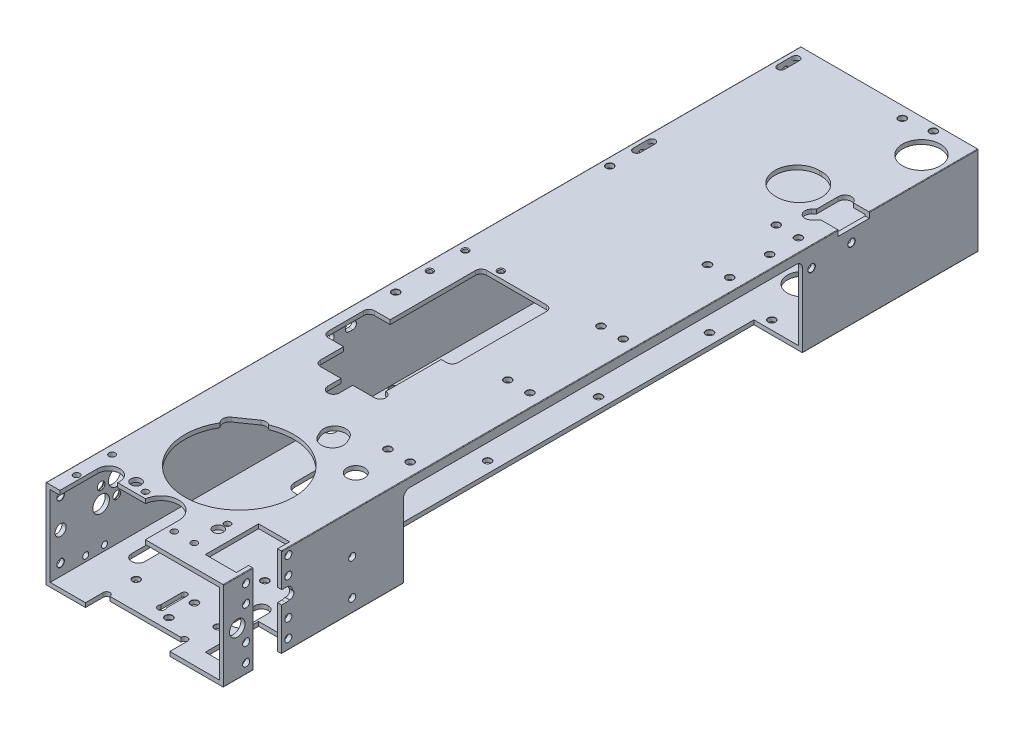
from build123d import *

# Parameters (mm, degrees)
SKETCH_1_W                  = 80
SKETCH_1_H                  = 40
SKETCH_1_W_2                = 76.2
SKETCH_1_H_2                = 36.2
EXTRUDE_1_DEPTH             = 340
FILLET_1_R                  = 0.25
CUT_EXTRUDE_1_REACH         = 346.674
SKETCH_2_R                  = 24.5
CUT_EXTRUDE_2813_REACH      = 346.458
SKETCH_124_R                = 1.6
CUT_EXTRUDE_4_REACH         = 346.674
CUT_EXTRUDE_5_DEPTH         = 22
SKETCH_53_R                 = 8.5
CUT_EXTRUDE_10_DEPTH        = 345.673758792
CUT_EXTRUDE_29_DEPTH        = 2.5
HOLE_WIZARD_3_2_AT_2_COUNT  = 2
HOLE_WIZARD_3_2_AT_2_PITCH  = 18.022485955
CUT_EXTRUDE_21_REACH        = 346.674
HOLE_WIZARD_3_D             = 3.2
HOLE_WIZARD_3_DEPTH         = 1.9
HOLE_WIZARD_3_CSINK_D       = 3.4
HOLE_WIZARD_3_CSINK_ANGLE   = 90
HOLE_WIZARD_3_TIP           = 0.96137699
HOLE_WIZARD_3_3_AT_2_COUNT  = 2
HOLE_WIZARD_3_3_AT_2_PITCH  = 50
HOLE_WIZARD_3_3_AT_3_COUNT  = 2
HOLE_WIZARD_3_3_AT_3_PITCH  = 100
HOLE_WIZARD_3_3_AT_4_COUNT  = 2
HOLE_WIZARD_3_3_AT_4_PITCH  = 50
HOLE_WIZARD_3_3_AT_5_COUNT  = 2
HOLE_WIZARD_3_3_AT_5_PITCH  = 119.34743399
HOLE_WIZARD_3_3_AT_6_COUNT  = 2
HOLE_WIZARD_3_3_AT_6_PITCH  = 189.1692364
HOLE_WIZARD_3_3_AT_7_COUNT  = 2
HOLE_WIZARD_3_3_AT_7_PITCH  = 189.002645484
HOLE_WIZARD_3_3_AT_8_COUNT  = 2
HOLE_WIZARD_3_3_AT_8_PITCH  = 194.054116164
HOLE_WIZARD_3_3_AT_9_COUNT  = 2
HOLE_WIZARD_3_3_AT_9_PITCH  = 125.566954252
HOLE_WIZARD_3_3_AT_10_COUNT = 2
HOLE_WIZARD_3_3_AT_10_PITCH = 129.740741481
HOLE_WIZARD_3_3_AT_11_COUNT = 2
HOLE_WIZARD_3_3_AT_11_PITCH = 108.772974585
HOLE_WIZARD_3_3_AT_12_COUNT = 2
HOLE_WIZARD_3_3_AT_12_PITCH = 74.271528865
HOLE_WIZARD_3_3_AT_13_COUNT = 2
HOLE_WIZARD_3_3_AT_13_PITCH = 71.85165273
HOLE_WIZARD_3_3_AT_14_COUNT = 2
HOLE_WIZARD_3_3_AT_14_PITCH = 121.961510322
HOLE_WIZARD_3_3_AT_15_COUNT = 2
HOLE_WIZARD_3_3_AT_15_PITCH = 133.421737359
HOLE_WIZARD_3_3_AT_16_COUNT = 2
HOLE_WIZARD_3_3_AT_16_PITCH = 97.059569338
HOLE_WIZARD_3_3_AT_17_COUNT = 2
HOLE_WIZARD_3_3_AT_17_PITCH = 101.652151969
CUT_EXTRUDE_1_2_REACH       = 346.674
SKETCH_90_R                 = 2.35
CUT_EXTRUDE_18376_REACH     = 346.674
CUT_EXTRUDE_27_REACH        = 346.674
SKETCH_81_R                 = 7
SKETCH_81_R_2               = 2.5
CUT_EXTRUDE_28_REACH        = 346.674
HOLE_WIZARD_M3_AT_2_COUNT   = 2
HOLE_WIZARD_M3_AT_2_PITCH   = 305.285505716
HOLE_WIZARD_M3_AT_3_COUNT   = 2
HOLE_WIZARD_M3_AT_3_PITCH   = 312.130200077
HOLE_WIZARD_M3_AT_4_COUNT   = 2
HOLE_WIZARD_M3_AT_4_PITCH   = 330.801042925
HOLE_WIZARD_M3_AT_5_COUNT   = 2
HOLE_WIZARD_M3_AT_5_PITCH   = 330.392085256
HOLE_WIZARD_M3_AT_6_COUNT   = 2
HOLE_WIZARD_M3_AT_6_PITCH   = 21.475800334
HOLE_WIZARD_M3_AT_7_COUNT   = 2
HOLE_WIZARD_M3_AT_7_PITCH   = 72.154071264
CUT_EXTRUDE_33_REACH        = 346.674
HOLE_WIZARD_4_40_D          = 3.2
HOLE_WIZARD_4_40_DEPTH      = 1.9
SKETCH_113_R                = 4
HD_1440A_DEPTH              = 12
HOLE_WIZARD_4_40_2_D        = 2.8448
HOLE_WIZARD_4_40_2_DEPTH    = 1.9
CUT_EXTRUDE_START           = -40
CUT_EXTRUDE_38_DEPTH        = 40
HOLE_WIZARD_3_2_2_D         = 3.2
HOLE_WIZARD_3_2_2_DEPTH     = 1.9
CUT_EXTRUDE_44_REACH        = 351.857
CUT_EXTRUDE_45_REACH        = 351.857
SKETCH_122_R                = 3.5
CUT_EXTRUDE_46_REACH        = 351.857
SKETCH_123_R                = 2.5
CUT_EXTRUDE_47_DEPTH        = 2.5
CUT_EXTRUDE_49_DEPTH        = 1.9
CUT_EXTRUDE_43506_REACH     = 346.674
CUT_EXTRUDE_50_REACH        = 351.857
SKETCH_130_R                = 1.35
CUT_EXTRUDE_51_REACH        = 346.458
SKETCH_131_R                = 3
F_4_40_SD_AT_2_COUNT        = 2
F_4_40_SD_AT_2_PITCH        = 16
F_4_40_SD_AT_3_COUNT        = 2
F_4_40_SD_AT_3_PITCH        = 22.627416998
HOLE_START                  = 38.1
HOLE_WIZARD_5_DEPTH         = 1.9
CUT_EXTRUDE_52_REACH        = 351.857
SKETCH_136_R                = 3.75


# Read off the part's stored shape, not the designer's step: Вырез-Вытянуть38, Зенковка для адаптера 5Ю
with BuildPart() as part:
    # Эскиз1 → Вытянуть1 (new body)
    with BuildSketch(Plane.XY):
        Rectangle(SKETCH_1_W, SKETCH_1_H)
        Rectangle(SKETCH_1_W_2, SKETCH_1_H_2, mode=Mode.SUBTRACT)
    extrude(amount=-EXTRUDE_1_DEPTH)

    # Скругление1
    fillet_1_edges = [part.edges().sort_by_distance(p)[0] for p in [
        (-40, 20, -170),
        (40, 20, -170),
        (40, -20, -170),
        (-40, -20, -170),
    ]]
    fillet(fillet_1_edges, radius=FILLET_1_R)

    # Эскиз2 → Cut-Extrude 1 (cut, up to next)
    with BuildSketch(Plane(origin=(0, 20, 0), x_dir=(-1, 0, 0), z_dir=(0, 1, 0)), mode=Mode.PRIVATE) as cut_extrude_1_sk1:
        with Locations((2.9, -50)):
            Circle(SKETCH_2_R)
    cut_extrude_1_tool1 = extrude(cut_extrude_1_sk1.sketch, amount=-CUT_EXTRUDE_1_REACH, mode=Mode.PRIVATE) & part.part
    # Эскиз2 → Cut-Extrude 1 (cut, up to next)
    with BuildSketch(Plane(origin=(0, 20, 0), x_dir=(-1, 0, 0), z_dir=(0, 1, 0)), mode=Mode.PRIVATE) as cut_extrude_1_sk2:
        with BuildLine():
            Line((15.806264575, -72.703075562), (23.711066125, -67.168073929))
            ThreePointArc((23.711066125, -67.168073929), (24.985142752, -64.887075741), (23.987750923, -62.472239614))
            ThreePointArc((23.987750923, -62.472239614), (18.95587085, -68.505648091), (12.273015665, -72.636178506))
            ThreePointArc((12.273015665, -72.636178506), (14.028744699, -73.245081853), (15.806264575, -72.703075562))
        make_face()
    cut_extrude_1_tool2 = extrude(cut_extrude_1_sk2.sketch, amount=-CUT_EXTRUDE_1_REACH, mode=Mode.PRIVATE) & part.part
    add(cut_extrude_1_tool1.solids().sort_by_distance((-2.9, 20, -50))[0], mode=Mode.SUBTRACT)
    add(cut_extrude_1_tool2.solids().sort_by_distance((-20.008621, 20, -68.33218))[0], mode=Mode.SUBTRACT)

    # Эскиз124 → Cut-Extrude 2813 (cut, up to next)
    with BuildSketch(Plane(origin=(0, -18.1, 0), x_dir=(1, 0, 0), z_dir=(0, 1, 0)), mode=Mode.PRIVATE) as cut_extrude_2813_sk1:
        with Locations(Location((-3.21, 15.2, 0), (0, 0, 270))):
            Circle(SKETCH_124_R)
    cut_extrude_2813_tool1 = extrude(cut_extrude_2813_sk1.sketch, amount=-CUT_EXTRUDE_2813_REACH, mode=Mode.PRIVATE) & part.part
    add(cut_extrude_2813_tool1.solids().sort_by_distance((-3.21, -18.1, -15.2))[0], mode=Mode.SUBTRACT)

    # Эскиз6 → Вырез-Вытянуть4 (cut, up to next)
    with BuildSketch(Plane.XZ.offset(20), mode=Mode.PRIVATE) as cut_extrude_4_sk1:
        with BuildLine():
            Line((-28, -42.5), (-27.9, -42.5))
            ThreePointArc((-27.9, -42.5), (-25.778679656, -41.621320344), (-24.9, -39.5))
            Line((-24.9, -39.5), (-24.9, -29.5))
            ThreePointArc((-24.9, -29.5), (-25.778679656, -27.378679656), (-27.9, -26.5))
            Line((-27.9, -26.5), (-28, -26.5))
            ThreePointArc((-28, -26.5), (-30.121320344, -27.378679656), (-31, -29.5))
            Line((-31, -29.5), (-31, -39.5))
            ThreePointArc((-31, -39.5), (-30.121320344, -41.621320344), (-28, -42.5))
        make_face()
    cut_extrude_4_tool1 = extrude(cut_extrude_4_sk1.sketch, amount=-CUT_EXTRUDE_4_REACH, mode=Mode.PRIVATE) & part.part
    # Эскиз6 → Вырез-Вытянуть4 (cut, up to next)
    with BuildSketch(Plane.XZ.offset(20), mode=Mode.PRIVATE) as cut_extrude_4_sk2:
        with BuildLine():
            Line((20.1, -40), (20.2, -40))
            ThreePointArc((20.2, -40), (22.321320344, -39.121320344), (23.2, -37))
            Line((23.2, -37), (23.2, -27))
            ThreePointArc((23.2, -27), (22.321320344, -24.878679656), (20.2, -24))
            Line((20.2, -24), (20.1, -24))
            ThreePointArc((20.1, -24), (17.978679656, -24.878679656), (17.1, -27))
            Line((17.1, -27), (17.1, -37))
            ThreePointArc((17.1, -37), (17.978679656, -39.121320344), (20.1, -40))
        make_face()
    cut_extrude_4_tool2 = extrude(cut_extrude_4_sk2.sketch, amount=-CUT_EXTRUDE_4_REACH, mode=Mode.PRIVATE) & part.part
    add(cut_extrude_4_tool1.solids().sort_by_distance((-27.95, -20, -34.5))[0], mode=Mode.SUBTRACT)
    add(cut_extrude_4_tool2.solids().sort_by_distance((20.15, -20, -32))[0], mode=Mode.SUBTRACT)

    # Эскиз7 → Вырез-Вытянуть5 (cut)
    with BuildSketch(Plane(origin=(40, 0, 0), x_dir=(0, 0, -1), z_dir=(1, 0, 0))):
        with BuildLine():
            Line((81, -20), (81, 13))
            ThreePointArc((81, 13), (81.878679656, 15.121320344), (84, 16))
            Line((84, 16), (258, 16))
            ThreePointArc((258, 16), (260.121320344, 15.121320344), (261, 13))
            Line((261, 13), (261, -20))
            Line((261, -20), (81, -20))
        make_face()
    extrude(amount=-CUT_EXTRUDE_5_DEPTH, mode=Mode.SUBTRACT)

    # Эскиз53 → Вырез-Вытянуть10 (cut, through all)
    with BuildSketch(Plane(origin=(0, 20, 0), x_dir=(1, 0, 0), z_dir=(0, 1, 0))):
        with Locations(Location((29.5, 325, 0), (0, 0, 270))):
            Circle(SKETCH_53_R)
    extrude(amount=-CUT_EXTRUDE_10_DEPTH, mode=Mode.SUBTRACT)

    # Эскиз83 → Вырез-Вытянуть29 (cut)
    with BuildSketch(Plane(origin=(0, 20, 0), x_dir=(1, 0, 0), z_dir=(0, 1, 0))):
        with BuildLine():
            Line((40, 291), (32.828427125, 291))
            ThreePointArc((32.828427125, 291), (29.492694064, 292.956795679), (27, 290))
            Line((27, 290), (27, 280.242640687))
            Line((27, 280.242640687), (25.878679656, 279.121320344))
            ThreePointArc((25.878679656, 279.121320344), (25.878679656, 274.878679656), (30.121320344, 274.878679656))
            Line((30.121320344, 274.878679656), (32.242640687, 277))
            Line((32.242640687, 277), (40, 277))
            Line((40, 277), (40, 291))
        make_face()
    extrude(amount=-CUT_EXTRUDE_29_DEPTH, mode=Mode.SUBTRACT)

    # Эскиз59 → Hole Wizard 3.2 (revolve, cut)
    with BuildSketch(Plane(origin=(40, 12, -283), x_dir=(0, 0, -1), z_dir=(0, 1, 0))):
        Polygon((0, 0), (0, 1.9), (1.7, 1.9), (1.6, 1.8), (1.6, 0.1), (1.7, 0), align=None)
    hole_wizard_3_2 = revolve(axis=Axis((46.35, 12, -283), (-1, 0, 0)), mode=Mode.SUBTRACT)

    # Hole Wizard 3.2 at 2: Hole Wizard 3.2 ×2
    with Locations(*[Vector(0, -0.04993761694389213, 0.9987523388778448) * (i * HOLE_WIZARD_3_2_AT_2_PITCH) for i in range(1, HOLE_WIZARD_3_2_AT_2_COUNT)]):
        add(hole_wizard_3_2, mode=Mode.SUBTRACT)

    # Эскиз66 → Вырез-Вытянуть21 (cut, up to next)
    with BuildSketch(Plane(origin=(0, 20, 0), x_dir=(1, 0, 0), z_dir=(0, 1, 0)), mode=Mode.PRIVATE) as cut_extrude_21_sk1:
        with BuildLine():
            Line((-33.71, 17), (-33.71, 0))
            Line((-33.71, 0), (4.79, 0))
            Line((4.79, 0), (4.79, 15))
            ThreePointArc((4.79, 15), (-2.7090167, 22.984298074), (-11.147253933, 16))
            Line((-11.147253933, 16), (-23.71, 16))
            Line((-23.71, 16), (-23.71, 17))
            ThreePointArc((-23.71, 17), (-28.71, 22), (-33.71, 17))
        make_face()
    cut_extrude_21_tool1 = extrude(cut_extrude_21_sk1.sketch, amount=-CUT_EXTRUDE_21_REACH, mode=Mode.PRIVATE) & part.part
    add(cut_extrude_21_tool1.solids().sort_by_distance((-14.127994, 20, -9.929758))[0], mode=Mode.SUBTRACT)

    # Hole Wizard 3
    with Locations(Plane(origin=(0, 20, 0), x_dir=(-1, 0, 0), z_dir=(0, 1, 0))):
        with Locations((-34.1, -90), (-34.1, -144), (-34.1, -265), (-24.1, -265), (-34.1, -252), (-24.1, -234), (-24.1, -186), (-10.9, -335), (-22.9, -337), (-24.1, -144), (-24.1, -90), (-34.1, -186), (-34.1, -234), (36.4, -250.5), (35.4, -153)):
            CounterSinkHole(HOLE_WIZARD_3_D / 2, HOLE_WIZARD_3_CSINK_D / 2, depth=HOLE_WIZARD_3_DEPTH, counter_sink_angle=HOLE_WIZARD_3_CSINK_ANGLE)
            with Locations((0, 0, -(HOLE_WIZARD_3_DEPTH + HOLE_WIZARD_3_TIP / 2))):  # 118° drill point
                Cone(0, HOLE_WIZARD_3_D / 2, HOLE_WIZARD_3_TIP, mode=Mode.SUBTRACT)

    # Эскиз71 → Hole Wizard 3 3 (revolve, cut)
    with BuildSketch(Plane(origin=(13, -20, -146), x_dir=(0, 0, -1), z_dir=(1, 0, 0))):
        Polygon((0, 0), (0, 1.9), (1.7, 1.9), (1.6, 1.8), (1.6, 0.1), (1.7, 0), align=None)
    hole_wizard_3_3 = revolve(axis=Axis((13, -26.35, -146), (0, 1, 0)), mode=Mode.SUBTRACT)

    # Hole Wizard 3 3 at 2: Hole Wizard 3 3 ×2
    with Locations(*[(0, 0, -i * HOLE_WIZARD_3_3_AT_2_PITCH) for i in range(1, HOLE_WIZARD_3_3_AT_2_COUNT)]):
        add(hole_wizard_3_3, mode=Mode.SUBTRACT)

    # Hole Wizard 3 3 at 3: Hole Wizard 3 3 ×2
    with Locations(*[(0, 0, -i * HOLE_WIZARD_3_3_AT_3_PITCH) for i in range(1, HOLE_WIZARD_3_3_AT_3_COUNT)]):
        add(hole_wizard_3_3, mode=Mode.SUBTRACT)

    # Hole Wizard 3 3 at 4: Hole Wizard 3 3 ×2
    with Locations(*[(0, 0, i * HOLE_WIZARD_3_3_AT_4_PITCH) for i in range(1, HOLE_WIZARD_3_3_AT_4_COUNT)]):
        add(hole_wizard_3_3, mode=Mode.SUBTRACT)

    # Hole Wizard 3 3 at 5: Hole Wizard 3 3 ×2
    with Locations(*[Vector(0.07624797363269382, 0, -0.9970888859659945) * (i * HOLE_WIZARD_3_3_AT_5_PITCH) for i in range(1, HOLE_WIZARD_3_3_AT_5_COUNT)]):
        add(hole_wizard_3_3, mode=Mode.SUBTRACT)

    # Hole Wizard 3 3 at 6: Hole Wizard 3 3 ×2
    with Locations(*[Vector(0.04229017440817784, 0, -0.9991053703931964) * (i * HOLE_WIZARD_3_3_AT_6_PITCH) for i in range(1, HOLE_WIZARD_3_3_AT_6_COUNT)]):
        add(hole_wizard_3_3, mode=Mode.SUBTRACT)

    # Hole Wizard 3 3 at 7: Hole Wizard 3 3 ×2
    with Locations(*[Vector(-0.005290931232409273, 0, -0.999986002925388) * (i * HOLE_WIZARD_3_3_AT_7_PITCH) for i in range(1, HOLE_WIZARD_3_3_AT_7_COUNT)]):
        add(hole_wizard_3_3, mode=Mode.SUBTRACT)

    # Hole Wizard 3 3 at 8: Hole Wizard 3 3 ×2
    with Locations(*[Vector(-0.22674087450392544, 0, -0.9739551200282255) * (i * HOLE_WIZARD_3_3_AT_8_PITCH) for i in range(1, HOLE_WIZARD_3_3_AT_8_COUNT)]):
        add(hole_wizard_3_3, mode=Mode.SUBTRACT)

    # Hole Wizard 3 3 at 9: Hole Wizard 3 3 ×2
    with Locations(*[Vector(0.03265190291856438, 0, 0.9994667844584916) * (i * HOLE_WIZARD_3_3_AT_9_PITCH) for i in range(1, HOLE_WIZARD_3_3_AT_9_COUNT)]):
        add(hole_wizard_3_3, mode=Mode.SUBTRACT)

    # Hole Wizard 3 3 at 10: Hole Wizard 3 3 ×2
    with Locations(*[Vector(-0.25358264200190983, 0, 0.9673137255695958) * (i * HOLE_WIZARD_3_3_AT_10_PITCH) for i in range(1, HOLE_WIZARD_3_3_AT_10_COUNT)]):
        add(hole_wizard_3_3, mode=Mode.SUBTRACT)

    # Hole Wizard 3 3 at 11: Hole Wizard 3 3 ×2
    with Locations(*[Vector(-0.26109426636935307, 0, 0.9653133087599328) * (i * HOLE_WIZARD_3_3_AT_11_PITCH) for i in range(1, HOLE_WIZARD_3_3_AT_11_COUNT)]):
        add(hole_wizard_3_3, mode=Mode.SUBTRACT)

    # Hole Wizard 3 3 at 12: Hole Wizard 3 3 ×2
    with Locations(*[Vector(0.27062860166018393, 0, 0.9626838317762761) * (i * HOLE_WIZARD_3_3_AT_12_PITCH) for i in range(1, HOLE_WIZARD_3_3_AT_12_COUNT)]):
        add(hole_wizard_3_3, mode=Mode.SUBTRACT)

    # Hole Wizard 3 3 at 13: Hole Wizard 3 3 ×2
    with Locations(*[Vector(0.09881470683356913, 0, 0.9951058505070685) * (i * HOLE_WIZARD_3_3_AT_13_PITCH) for i in range(1, HOLE_WIZARD_3_3_AT_13_COUNT)]):
        add(hole_wizard_3_3, mode=Mode.SUBTRACT)

    # Hole Wizard 3 3 at 14: Hole Wizard 3 3 ×2
    with Locations(*[Vector(-0.08691266590600934, 0, 0.9962159346773722) * (i * HOLE_WIZARD_3_3_AT_14_PITCH) for i in range(1, HOLE_WIZARD_3_3_AT_14_COUNT)]):
        add(hole_wizard_3_3, mode=Mode.SUBTRACT)

    # Hole Wizard 3 3 at 15: Hole Wizard 3 3 ×2
    with Locations(*[Vector(-0.07944732402522112, 0, 0.9968390655994736) * (i * HOLE_WIZARD_3_3_AT_15_PITCH) for i in range(1, HOLE_WIZARD_3_3_AT_15_COUNT)]):
        add(hole_wizard_3_3, mode=Mode.SUBTRACT)

    # Hole Wizard 3 3 at 16: Hole Wizard 3 3 ×2
    with Locations(*[Vector(-0.03503003385656783, 0, 0.9993862600256258) * (i * HOLE_WIZARD_3_3_AT_16_PITCH) for i in range(1, HOLE_WIZARD_3_3_AT_16_COUNT)]):
        add(hole_wizard_3_3, mode=Mode.SUBTRACT)

    # Hole Wizard 3 3 at 17: Hole Wizard 3 3 ×2
    with Locations(*[Vector(-0.29905908936552433, 0, 0.9542345943571022) * (i * HOLE_WIZARD_3_3_AT_17_PITCH) for i in range(1, HOLE_WIZARD_3_3_AT_17_COUNT)]):
        add(hole_wizard_3_3, mode=Mode.SUBTRACT)

    # Эскиз90 → Cut-Extrude 1 2 (cut, up to next)
    with BuildSketch(Plane(origin=(0, 20, 0), x_dir=(1, 0, 0), z_dir=(0, 1, 0)), mode=Mode.PRIVATE) as cut_extrude_1_2_sk1:
        with Locations(Location((17.1, 20.5, 0), (0, 0, 270))):
            Circle(SKETCH_90_R)
    cut_extrude_1_2_tool1 = extrude(cut_extrude_1_2_sk1.sketch, amount=-CUT_EXTRUDE_1_2_REACH, mode=Mode.PRIVATE) & part.part
    # Эскиз90 → Cut-Extrude 1 2 (cut, up to next)
    with BuildSketch(Plane(origin=(0, 20, 0), x_dir=(1, 0, 0), z_dir=(0, 1, 0)), mode=Mode.PRIVATE) as cut_extrude_1_2_sk2:
        with Locations(Location((-19.9, 20.5, 0), (0, 0, 270))):
            Circle(SKETCH_90_R)
    cut_extrude_1_2_tool2 = extrude(cut_extrude_1_2_sk2.sketch, amount=-CUT_EXTRUDE_1_2_REACH, mode=Mode.PRIVATE) & part.part
    add(cut_extrude_1_2_tool1.solids().sort_by_distance((17.1, 20, -20.5))[0], mode=Mode.SUBTRACT)
    add(cut_extrude_1_2_tool2.solids().sort_by_distance((-19.9, 20, -20.5))[0], mode=Mode.SUBTRACT)

    # Эскиз79 → Cut-Extrude 18376 (cut, up to next)
    with BuildSketch(Plane(origin=(0, 20, 0), x_dir=(1, 0, 0), z_dir=(0, 1, 0)), mode=Mode.PRIVATE) as cut_extrude_18376_sk1:
        with BuildLine():
            Line((1.1, 137), (3.6, 137))
            ThreePointArc((3.6, 137), (5.367766953, 137.732233047), (6.1, 139.5))
            Line((6.1, 139.5), (6.1, 179.5))
            ThreePointArc((6.1, 179.5), (5.367766953, 181.267766953), (3.6, 182))
            Line((3.6, 182), (-23.4, 182))
            ThreePointArc((-23.4, 182), (-25.167766953, 181.267766953), (-25.9, 179.5))
            Line((-25.9, 179.5), (-25.9, 141))
            Line((-25.9, 141), (-32.9, 141))
            ThreePointArc((-32.9, 141), (-34.667766953, 140.267766953), (-35.4, 138.5))
            Line((-35.4, 138.5), (-35.4, 122.5))
            ThreePointArc((-35.4, 122.5), (-34.667766953, 120.732233047), (-32.9, 120))
            Line((-32.9, 120), (-25.9, 120))
            Line((-25.9, 120), (-25.9, 109.5))
            ThreePointArc((-25.9, 109.5), (-25.167766953, 107.732233047), (-23.4, 107))
            Line((-23.4, 107), (-14.05, 107))
            Line((-14.05, 107), (-14.05, 101))
            ThreePointArc((-14.05, 101), (-11.4, 98.35), (-8.75, 101))
            Line((-8.75, 101), (-8.75, 107))
            Line((-8.75, 107), (1.1, 107))
            ThreePointArc((1.1, 107), (3.6, 109.5), (1.1, 112))
            Line((1.1, 112), (1.1, 137))
        make_face()
    cut_extrude_18376_tool1 = extrude(cut_extrude_18376_sk1.sketch, amount=-CUT_EXTRUDE_18376_REACH, mode=Mode.PRIVATE) & part.part
    add(cut_extrude_18376_tool1.solids().sort_by_distance((-12.32314, 20, -143.880761))[0], mode=Mode.SUBTRACT)

    # Эскиз81 → Вырез-Вытянуть27 (cut, up to next)
    with BuildSketch(Plane.XZ.offset(20), mode=Mode.PRIVATE) as cut_extrude_27_sk1:
        with Locations(Location((15.1, -286, 0), (0, 0, 270))):
            Circle(SKETCH_81_R)
    cut_extrude_27_tool1 = extrude(cut_extrude_27_sk1.sketch, amount=-CUT_EXTRUDE_27_REACH, mode=Mode.PRIVATE) & part.part
    # Эскиз81 → Вырез-Вытянуть27 (cut, up to next)
    with BuildSketch(Plane.XZ.offset(20), mode=Mode.PRIVATE) as cut_extrude_27_sk2:
        with Locations(Location((8.1, -80.5, 0), (0, 0, 270))):
            Circle(SKETCH_81_R)
    cut_extrude_27_tool2 = extrude(cut_extrude_27_sk2.sketch, amount=-CUT_EXTRUDE_27_REACH, mode=Mode.PRIVATE) & part.part
    # Эскиз81 → Вырез-Вытянуть27 (cut, up to next)
    with BuildSketch(Plane.XZ.offset(20), mode=Mode.PRIVATE) as cut_extrude_27_sk3:
        with Locations(Location((-35.4, -153, 0), (0, 0, 270))):
            Circle(SKETCH_81_R_2)
    cut_extrude_27_tool3 = extrude(cut_extrude_27_sk3.sketch, amount=-CUT_EXTRUDE_27_REACH, mode=Mode.PRIVATE) & part.part
    # Эскиз81 → Вырез-Вытянуть27 (cut, up to next)
    with BuildSketch(Plane.XZ.offset(20), mode=Mode.PRIVATE) as cut_extrude_27_sk4:
        with Locations(Location((-34.9, -123, 0), (0, 0, 270))):
            Circle(SKETCH_81_R_2)
    cut_extrude_27_tool4 = extrude(cut_extrude_27_sk4.sketch, amount=-CUT_EXTRUDE_27_REACH, mode=Mode.PRIVATE) & part.part
    add(cut_extrude_27_tool1.solids().sort_by_distance((15.1, -20, -286))[0], mode=Mode.SUBTRACT)
    add(cut_extrude_27_tool2.solids().sort_by_distance((8.1, -20, -80.5))[0], mode=Mode.SUBTRACT)
    add(cut_extrude_27_tool3.solids().sort_by_distance((-35.4, -20, -153))[0], mode=Mode.SUBTRACT)
    add(cut_extrude_27_tool4.solids().sort_by_distance((-34.9, -20, -123))[0], mode=Mode.SUBTRACT)

    # Эскиз82 → Вырез-Вытянуть28 (cut, up to next)
    with BuildSketch(Plane(origin=(0, 20, 0), x_dir=(1, 0, 0), z_dir=(0, 1, 0)), mode=Mode.PRIVATE) as cut_extrude_28_sk1:
        with BuildLine():
            Line((3.127864045, 79.263932023), (2.127864045, 81.263932023))
            ThreePointArc((2.127864045, 81.263932023), (4.363932023, 87.972135955), (11.072135955, 85.736067977))
            Line((11.072135955, 85.736067977), (12.072135955, 83.736067977))
            ThreePointArc((12.072135955, 83.736067977), (9.836067977, 77.027864045), (3.127864045, 79.263932023))
        make_face()
    cut_extrude_28_tool1 = extrude(cut_extrude_28_sk1.sketch, amount=-CUT_EXTRUDE_28_REACH, mode=Mode.PRIVATE) & part.part
    # Эскиз82 → Вырез-Вытянуть28 (cut, up to next)
    with BuildSketch(Plane(origin=(0, 20, 0), x_dir=(1, 0, 0), z_dir=(0, 1, 0)), mode=Mode.PRIVATE) as cut_extrude_28_sk2:
        with BuildLine():
            Line((12.5, 296), (13.5, 296))
            ThreePointArc((13.5, 296), (23.5, 286), (13.5, 276))
            Line((13.5, 276), (12.5, 276))
            ThreePointArc((12.5, 276), (2.5, 286), (12.5, 296))
        make_face()
    cut_extrude_28_tool2 = extrude(cut_extrude_28_sk2.sketch, amount=-CUT_EXTRUDE_28_REACH, mode=Mode.PRIVATE) & part.part
    add(cut_extrude_28_tool1.solids().sort_by_distance((7.1, 20, -82.5))[0], mode=Mode.SUBTRACT)
    add(cut_extrude_28_tool2.solids().sort_by_distance((13, 20, -286))[0], mode=Mode.SUBTRACT)

    # Эскиз84 → Отв. под M3 (слева) (revolve, cut)
    with BuildSketch(Plane(origin=(-40, -5.1, -335), x_dir=(0, 0, 1), z_dir=(0, 1, 0))):
        Polygon((0, 0), (0, 1.9), (1.7, 1.9), (1.6, 1.8), (1.6, 0.1), (1.7, 0), align=None)
    hole_wizard_m3 = revolve(axis=Axis((-46.35, -5.1, -335), (1, 0, 0)), mode=Mode.SUBTRACT)

    # Отв. под M3 (слева) at 2: Отв. под M3 (слева) ×2
    with Locations(*[Vector(0, 0.043238213910814435, 0.9990647911210778) * (i * HOLE_WIZARD_M3_AT_2_PITCH) for i in range(1, HOLE_WIZARD_M3_AT_2_COUNT)]):
        add(hole_wizard_m3, mode=Mode.SUBTRACT)

    # Отв. под M3 (слева) at 3: Отв. под M3 (слева) ×2
    with Locations(*[Vector(0, 0.019639240286557832, 0.9998071315213585) * (i * HOLE_WIZARD_M3_AT_3_PITCH) for i in range(1, HOLE_WIZARD_M3_AT_3_COUNT)]):
        add(hole_wizard_m3, mode=Mode.SUBTRACT)

    # Отв. под M3 (слева) at 4: Отв. под M3 (слева) ×2
    with Locations(*[Vector(0, 0.055017964390604315, 0.9984853647371674) * (i * HOLE_WIZARD_M3_AT_4_PITCH) for i in range(1, HOLE_WIZARD_M3_AT_4_COUNT)]):
        add(hole_wizard_m3, mode=Mode.SUBTRACT)

    # Отв. под M3 (слева) at 5: Отв. под M3 (слева) ×2
    with Locations(*[Vector(0, -0.023608313722010763, 0.9997212849205538) * (i * HOLE_WIZARD_M3_AT_5_PITCH) for i in range(1, HOLE_WIZARD_M3_AT_5_COUNT)]):
        add(hole_wizard_m3, mode=Mode.SUBTRACT)

    # Отв. под M3 (слева) at 6: Отв. под M3 (слева) ×2
    with Locations(*[Vector(0, 0.9825012186517182, 0.18625615519463698) * (i * HOLE_WIZARD_M3_AT_6_PITCH) for i in range(1, HOLE_WIZARD_M3_AT_6_COUNT)]):
        add(hole_wizard_m3, mode=Mode.SUBTRACT)

    # Отв. под M3 (слева) at 7: Отв. под M3 (слева) ×2
    with Locations(*[Vector(0, 0.29242979128286045, 0.9562869951903888) * (i * HOLE_WIZARD_M3_AT_7_PITCH) for i in range(1, HOLE_WIZARD_M3_AT_7_COUNT)]):
        add(hole_wizard_m3, mode=Mode.SUBTRACT)

    # Эскиз91 → Вырез-Вытянуть33 (cut, up to next)
    with BuildSketch(Plane.XZ.offset(20), mode=Mode.PRIVATE) as cut_extrude_33_sk1:
        with BuildLine():
            Line((15.79, 0), (-22.21, 0))
            Line((-22.21, 0), (-22.21, -8))
            ThreePointArc((-22.21, -8), (-20.71, -9.5), (-19.21, -8))
            Line((-19.21, -8), (-3.21, -8))
            Line((-3.21, -8), (12.79, -8))
            ThreePointArc((12.79, -8), (14.29, -9.5), (15.79, -8))
            Line((15.79, -8), (15.79, 0))
        make_face()
    cut_extrude_33_tool1 = extrude(cut_extrude_33_sk1.sketch, amount=-CUT_EXTRUDE_33_REACH, mode=Mode.PRIVATE) & part.part
    # Эскиз91 → Вырез-Вытянуть33 (cut, up to next)
    with BuildSketch(Plane.XZ.offset(20), mode=Mode.PRIVATE) as cut_extrude_33_sk2:
        with BuildLine():
            Line((-18, -90), (-5, -90))
            ThreePointArc((-5, -90), (-2.171572875, -91.171572875), (-1, -94))
            Line((-1, -94), (-1, -153))
            ThreePointArc((-1, -153), (-2.171572875, -155.828427125), (-5, -157))
            Line((-5, -157), (-18, -157))
            ThreePointArc((-18, -157), (-20.828427125, -155.828427125), (-22, -153))
            Line((-22, -153), (-22, -94))
            ThreePointArc((-22, -94), (-20.828427125, -91.171572875), (-18, -90))
        make_face()
    cut_extrude_33_tool2 = extrude(cut_extrude_33_sk2.sketch, amount=-CUT_EXTRUDE_33_REACH, mode=Mode.PRIVATE) & part.part
    add(cut_extrude_33_tool1.solids().sort_by_distance((-3.21, -20, -4.10536))[0], mode=Mode.SUBTRACT)
    add(cut_extrude_33_tool2.solids().sort_by_distance((-11.5, -20, -123.5))[0], mode=Mode.SUBTRACT)

    # Hole Wizard 4-40
    with Locations(Plane(origin=(40, 0, 0), x_dir=(0, 0, -1), z_dir=(1, 0, 0))):
        with Locations((58, -14.1), (58, 1.9)):
            Hole(HOLE_WIZARD_4_40_D / 2, depth=HOLE_WIZARD_4_40_DEPTH)

    # Эскиз113 → Вырез_под_HD-1440A (cut)
    with BuildSketch(Plane(origin=(0, 20, 0), x_dir=(1, 0, 0), z_dir=(0, 1, 0))):
        with Locations(Location((26.1, 73.5, 0), (0, 0, 270))):
            Circle(SKETCH_113_R)
    extrude(amount=-HD_1440A_DEPTH, mode=Mode.SUBTRACT)

    # Hole Wizard 4-40 2
    with Locations(Plane(origin=(0, 20, 0), x_dir=(-1, 0, 0), z_dir=(0, 1, 0))):
        with Locations((13.9, -18.7), (-8.1, -9.7), (35.9, -9.7), (35.9, -25.7), (-17.1, -9.7), (-17.1, -24.7)):
            Hole(HOLE_WIZARD_4_40_2_D / 2, depth=HOLE_WIZARD_4_40_2_DEPTH)

    # Вырез-Вытянуть38 outline → Вырез-Вытянуть38 (cut)
    with BuildSketch(Plane(origin=(0, 20, 0), x_dir=(1, 0, 0), z_dir=(0, 1, 0)).offset(CUT_EXTRUDE_START)):
        Polygon((38.1, 31.7), (24.1, 31.7), (24.1, 7.7), (38.1, 7.7), (38.1, 13.2), (40, 13.2), (40, 26.2), (38.1, 26.2), align=None)
    extrude(amount=CUT_EXTRUDE_38_DEPTH, mode=Mode.SUBTRACT)

    # Hole Wizard 3.2 2
    with Locations(Plane(origin=(40, 0, 0), x_dir=(0, 0, -1), z_dir=(1, 0, 0))):
        with Locations((10.2, 15.5), (10.2, -15.5), (29.2, -15.5), (29.2, 17), (10.2, 7.5), (10.2, -7.5), (29.2, -7.5), (29.2, 9)):
            Hole(HOLE_WIZARD_3_2_2_D / 2, depth=HOLE_WIZARD_3_2_2_DEPTH)

    # Эскиз121 → Вырез-Вытянуть44 (cut, up to next)
    with BuildSketch(Plane(origin=(40, 0, 0), x_dir=(0, 0, -1), z_dir=(1, 0, 0)), mode=Mode.PRIVATE) as cut_extrude_44_sk1:
        with BuildLine():
            ThreePointArc((28.2, -1), (31.2, 2), (28.2, 5))
            Line((28.2, 5), (26.2, 5))
            Line((26.2, 5), (26.2, -1))
            Line((26.2, -1), (28.2, -1))
        make_face()
    cut_extrude_44_tool1 = extrude(cut_extrude_44_sk1.sketch, amount=-CUT_EXTRUDE_44_REACH, mode=Mode.PRIVATE) & part.part
    add(cut_extrude_44_tool1.solids().sort_by_distance((40, 2, -28.429558))[0], mode=Mode.SUBTRACT)

    # Эскиз122 → Вырез-Вытянуть45 (cut, up to next)
    with BuildSketch(Plane(origin=(40, 0, 0), x_dir=(0, 0, -1), z_dir=(1, 0, 0)), mode=Mode.PRIVATE) as cut_extrude_45_sk1:
        with Locations(Location((6.2, 0, 0), (0, 0, 90))):
            Circle(SKETCH_122_R)
    cut_extrude_45_tool1 = extrude(cut_extrude_45_sk1.sketch, amount=-CUT_EXTRUDE_45_REACH, mode=Mode.PRIVATE) & part.part
    add(cut_extrude_45_tool1.solids().sort_by_distance((40, 0, -6.2))[0], mode=Mode.SUBTRACT)

    # Эскиз123 → Вырез-Вытянуть46 (cut, up to next)
    with BuildSketch(Plane.ZY.offset(40), mode=Mode.PRIVATE) as cut_extrude_46_sk1:
        with Locations((-4.7, 0)):
            Circle(SKETCH_123_R)
    cut_extrude_46_tool1 = extrude(cut_extrude_46_sk1.sketch, amount=-CUT_EXTRUDE_46_REACH, mode=Mode.PRIVATE) & part.part
    add(cut_extrude_46_tool1.solids().sort_by_distance((-40, 0, -4.7))[0], mode=Mode.SUBTRACT)

    # Эскиз125 → Вырез-Вытянуть47 (cut)
    with BuildSketch(Plane(origin=(0, 20, 0), x_dir=(1, 0, 0), z_dir=(0, 1, 0))):
        with BuildLine():
            Line((-34.8, 334.35), (-34.8, 327.65))
            ThreePointArc((-34.8, 327.65), (-36.45, 326), (-38.1, 327.65))
            Line((-38.1, 327.65), (-38.1, 334.35))
            ThreePointArc((-38.1, 334.35), (-36.45, 336), (-34.8, 334.35))
        make_face()
        with BuildLine():
            Line((-34.8, 269.35), (-34.8, 262.65))
            ThreePointArc((-34.8, 262.65), (-36.45, 261), (-38.1, 262.65))
            Line((-38.1, 262.65), (-38.1, 269.35))
            ThreePointArc((-38.1, 269.35), (-36.45, 271), (-34.8, 269.35))
        make_face()
    extrude(amount=-CUT_EXTRUDE_47_DEPTH, mode=Mode.SUBTRACT)

    # Эскиз127<3> → Вырез-Вытянуть49 (cut)
    with BuildSketch(Plane.ZY.offset(40)):
        with BuildLine():
            Line((-136.35, 12.35), (-134.65, 12.35))
            ThreePointArc((-134.65, 12.35), (-133, 14), (-134.65, 15.65))
            Line((-134.65, 15.65), (-136.35, 15.65))
            ThreePointArc((-136.35, 15.65), (-138, 14), (-136.35, 12.35))
        make_face()
        with BuildLine():
            Line((-126.35, 12.35), (-124.65, 12.35))
            ThreePointArc((-124.65, 12.35), (-123, 14), (-124.65, 15.65))
            Line((-124.65, 15.65), (-126.35, 15.65))
            ThreePointArc((-126.35, 15.65), (-128, 14), (-126.35, 12.35))
        make_face()
    extrude(amount=-CUT_EXTRUDE_49_DEPTH, mode=Mode.SUBTRACT)

    # Эскиз129 → Cut-Extrude 43506 (cut, up to next)
    with BuildSketch(Plane.XZ.offset(20), mode=Mode.PRIVATE) as cut_extrude_43506_sk1:
        with BuildLine():
            Line((-1.96, -15), (-1.96, -25.55))
            ThreePointArc((-1.96, -25.55), (-3.21, -26.8), (-4.46, -25.55))
            Line((-4.46, -25.55), (-4.46, -15))
            ThreePointArc((-4.46, -15), (-3.21, -13.75), (-1.96, -15))
        make_face()
    cut_extrude_43506_tool1 = extrude(cut_extrude_43506_sk1.sketch, amount=-CUT_EXTRUDE_43506_REACH, mode=Mode.PRIVATE) & part.part
    add(cut_extrude_43506_tool1.solids().sort_by_distance((-3.21, -20, -20.275))[0], mode=Mode.SUBTRACT)

    # Эскиз130 → Вырез-Вытянуть50 (cut, up to next)
    with BuildSketch(Plane.ZY.offset(40), mode=Mode.PRIVATE) as cut_extrude_50_sk1:
        with Locations((-24.5, -15.6)):
            Circle(SKETCH_130_R)
    cut_extrude_50_tool1 = extrude(cut_extrude_50_sk1.sketch, amount=-CUT_EXTRUDE_50_REACH, mode=Mode.PRIVATE) & part.part
    # Эскиз130 → Вырез-Вытянуть50 (cut, up to next)
    with BuildSketch(Plane.ZY.offset(40), mode=Mode.PRIVATE) as cut_extrude_50_sk2:
        with Locations((-16, -15.6)):
            Circle(SKETCH_130_R)
    cut_extrude_50_tool2 = extrude(cut_extrude_50_sk2.sketch, amount=-CUT_EXTRUDE_50_REACH, mode=Mode.PRIVATE) & part.part
    add(cut_extrude_50_tool1.solids().sort_by_distance((-40, -15.6, -24.5))[0], mode=Mode.SUBTRACT)
    add(cut_extrude_50_tool2.solids().sort_by_distance((-40, -15.6, -16))[0], mode=Mode.SUBTRACT)

    # Эскиз131 → Вырез-Вытянуть51 (cut, up to next)
    with BuildSketch(Plane(origin=(0, -18.1, 0), x_dir=(1, 0, 0), z_dir=(0, 1, 0)), mode=Mode.PRIVATE) as cut_extrude_51_sk1:
        with Locations(Location((4.1, 335.5, 0), (0, 0, 270))):
            Circle(SKETCH_131_R)
    cut_extrude_51_tool1 = extrude(cut_extrude_51_sk1.sketch, amount=-CUT_EXTRUDE_51_REACH, mode=Mode.PRIVATE) & part.part
    # Эскиз131 → Вырез-Вытянуть51 (cut, up to next)
    with BuildSketch(Plane(origin=(0, -18.1, 0), x_dir=(1, 0, 0), z_dir=(0, 1, 0)), mode=Mode.PRIVATE) as cut_extrude_51_sk2:
        with Locations(Location((-11.9, 335.5, 0), (0, 0, 270))):
            Circle(SKETCH_131_R)
    cut_extrude_51_tool2 = extrude(cut_extrude_51_sk2.sketch, amount=-CUT_EXTRUDE_51_REACH, mode=Mode.PRIVATE) & part.part
    add(cut_extrude_51_tool1.solids().sort_by_distance((4.1, -18.1, -335.5))[0], mode=Mode.SUBTRACT)
    add(cut_extrude_51_tool2.solids().sort_by_distance((-11.9, -18.1, -335.5))[0], mode=Mode.SUBTRACT)

    # Эскиз132 → 4-40_для_SD (revolve, cut)
    with BuildSketch(Plane(origin=(-20, 20, -185), x_dir=(0, 0, 1), z_dir=(1, 0, 0))):
        Polygon((0, 0), (0, 1.9), (1.524, 1.9), (1.1303, 1.624328292), (1.1303, 0.275671708), (1.524, 0), align=None)
    f_4_40_sd = revolve(axis=Axis((-20, 26.35, -185), (0, -1, 0)), mode=Mode.SUBTRACT)

    # 4-40_для_SD at 2: 4-40_для_SD ×2
    with Locations(*[(-i * F_4_40_SD_AT_2_PITCH, 0, 0) for i in range(1, F_4_40_SD_AT_2_COUNT)]):
        add(f_4_40_sd, mode=Mode.SUBTRACT)

    # 4-40_для_SD at 3: 4-40_для_SD ×2
    with Locations(*[Vector(-0.7071067811865478, 0, 0.7071067811865474) * (i * F_4_40_SD_AT_3_PITCH) for i in range(1, F_4_40_SD_AT_3_COUNT)]):
        add(f_4_40_sd, mode=Mode.SUBTRACT)

    # Зенковка для адаптера 5Ю outline → Зенковка для адаптера 5Ю (cut)
    with BuildSketch(Plane.YZ.offset(HOLE_START)):
        with BuildLine():
            ThreePointArc((-0.64962308, -29.606946174), (0.211674766, -31.518541672), (2.281923123, -31.186723849))
            ThreePointArc((2.281923123, -31.186723849), (0.576825679, -30.840942039), (-0.64962308, -29.606946174))
        make_face()
    extrude(amount=HOLE_WIZARD_5_DEPTH, mode=Mode.SUBTRACT)

    # Hole Wizard 5 2 outline → Hole Wizard 5 2 (revolve, cut)
    with BuildSketch(Plane(origin=(0, 1.03, -30), x_dir=(0, 1, 0), z_dir=(0, 0, -1))):
        Polygon((1.725, -38.1), (0, -38.1), (0, -40), (3, -40), (1.7, -38.7), (1.7, -38.125), align=None)
    revolve(axis=Axis((0, 1.03, -30), (1, 0, 0)), mode=Mode.SUBTRACT)

    # Hole Wizard 5 3 outline → Hole Wizard 5 3 (revolve, cut)
    with BuildSketch(Plane(origin=(0, 8.1, -22.93), x_dir=(0, 1, 0), z_dir=(0, 0, -1))):
        Polygon((1.725, -38.1), (0, -38.1), (0, -40), (3, -40), (1.7, -38.7), (1.7, -38.125), align=None)
    revolve(axis=Axis((0, 8.1, -22.93), (1, 0, 0)), mode=Mode.SUBTRACT)

    # Эскиз136 → Вырез-Вытянуть52 (cut, up to next)
    with BuildSketch(Plane.ZY.offset(40), mode=Mode.PRIVATE) as cut_extrude_52_sk1:
        with Locations((-22.93, 1.03)):
            Circle(SKETCH_136_R)
    cut_extrude_52_tool1 = extrude(cut_extrude_52_sk1.sketch, amount=-CUT_EXTRUDE_52_REACH, mode=Mode.PRIVATE) & part.part
    # Эскиз136 → Вырез-Вытянуть52 (cut, up to next)
    with BuildSketch(Plane.ZY.offset(40), mode=Mode.PRIVATE) as cut_extrude_52_sk2:
        with Locations((-30, 8.1)):
            Circle(SKETCH_136_R)
    cut_extrude_52_tool2 = extrude(cut_extrude_52_sk2.sketch, amount=-CUT_EXTRUDE_52_REACH, mode=Mode.PRIVATE) & part.part
    add(cut_extrude_52_tool1.solids().sort_by_distance((-40, 1.03, -22.93))[0], mode=Mode.SUBTRACT)
    add(cut_extrude_52_tool2.solids().sort_by_distance((-40, 8.1, -30))[0], mode=Mode.SUBTRACT)


solid = part.part
